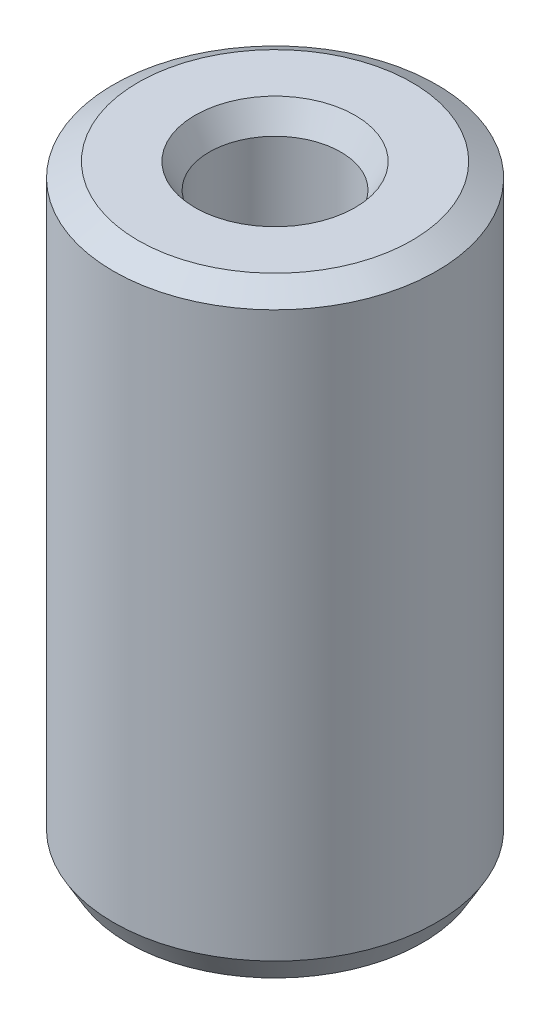
from build123d import *
from OCP.BRepFilletAPI import BRepFilletAPI_MakeChamfer

# Parameters (mm, degrees)
SKETCH1_R           = 5
BOSS_EXTRUDE1_DEPTH = 18.653289421
SKETCH2_R           = 2.034348067
CUT_EXTRUDE1_DEPTH  = 20.948564014
CHAMFER1_SIZE       = 0.441082101
CHAMFER1_SIZE2      = 0.763976609


with BuildPart() as part:
    # Sketch1 → Boss-Extrude1 (new body)
    with BuildSketch(Plane(origin=(0, 0, 0), x_dir=(1, 0, 0), z_dir=(0, 1, 0))):
        Circle(SKETCH1_R)
    extrude(amount=BOSS_EXTRUDE1_DEPTH)

    # Sketch2 → Cut-Extrude1 (cut, through all)
    with BuildSketch(Plane(origin=(0, 0, 0), x_dir=(1, 0, 0), z_dir=(0, 1, 0))):
        Circle(SKETCH2_R)
    extrude(amount=CUT_EXTRUDE1_DEPTH, mode=Mode.SUBTRACT)

    # Chamfer1: one chamfer whose edges measure the first distance from different faces: ONE call of the kernel's chamfer builder (chamfer() names one face for all edges)
    chamfer1_edges_1 = [part.edges().sort_by_distance(p)[0] for p in [
        (-2.034348067, 18.653289421, 0),
    ]]
    chamfer1_side_1 = [part.faces().sort_by_distance(p)[0] for p in [
        (-4.858578644, 18.653289421, 0),
    ]]
    chamfer1_edges_2 = [part.edges().sort_by_distance(p)[0] for p in [
        (-2.034348067, 0, 0),
    ]]
    chamfer1_side_2 = [part.faces().sort_by_distance(p)[0] for p in [
        (-2.034348067, 9.326644711, 0),
    ]]
    chamfer1_edges_3 = [part.edges().sort_by_distance(p)[0] for p in [
        (-5, 0, 0),
    ]]
    chamfer1_side_3 = [part.faces().sort_by_distance(p)[0] for p in [
        (-4.858578644, 0, 0),
    ]]
    chamfer1_edges_4 = [part.edges().sort_by_distance(p)[0] for p in [
        (-5, 18.653289421, 0),
    ]]
    chamfer1_side_4 = [part.faces().sort_by_distance(p)[0] for p in [
        (-5, 9.326644711, 0),
    ]]
    chamfer1 = BRepFilletAPI_MakeChamfer(part.part.solid().wrapped)
    for e in chamfer1_edges_1:
        chamfer1.Add(CHAMFER1_SIZE, CHAMFER1_SIZE2, e.wrapped, chamfer1_side_1[0].wrapped)  # the first distance lies on this face
    for e in chamfer1_edges_2:
        chamfer1.Add(CHAMFER1_SIZE, CHAMFER1_SIZE2, e.wrapped, chamfer1_side_2[0].wrapped)  # the first distance lies on this face
    for e in chamfer1_edges_3:
        chamfer1.Add(CHAMFER1_SIZE, CHAMFER1_SIZE2, e.wrapped, chamfer1_side_3[0].wrapped)  # the first distance lies on this face
    for e in chamfer1_edges_4:
        chamfer1.Add(CHAMFER1_SIZE, CHAMFER1_SIZE2, e.wrapped, chamfer1_side_4[0].wrapped)  # the first distance lies on this face
    add(Compound.cast(chamfer1.Shape()), mode=Mode.REPLACE)


solid = part.part
